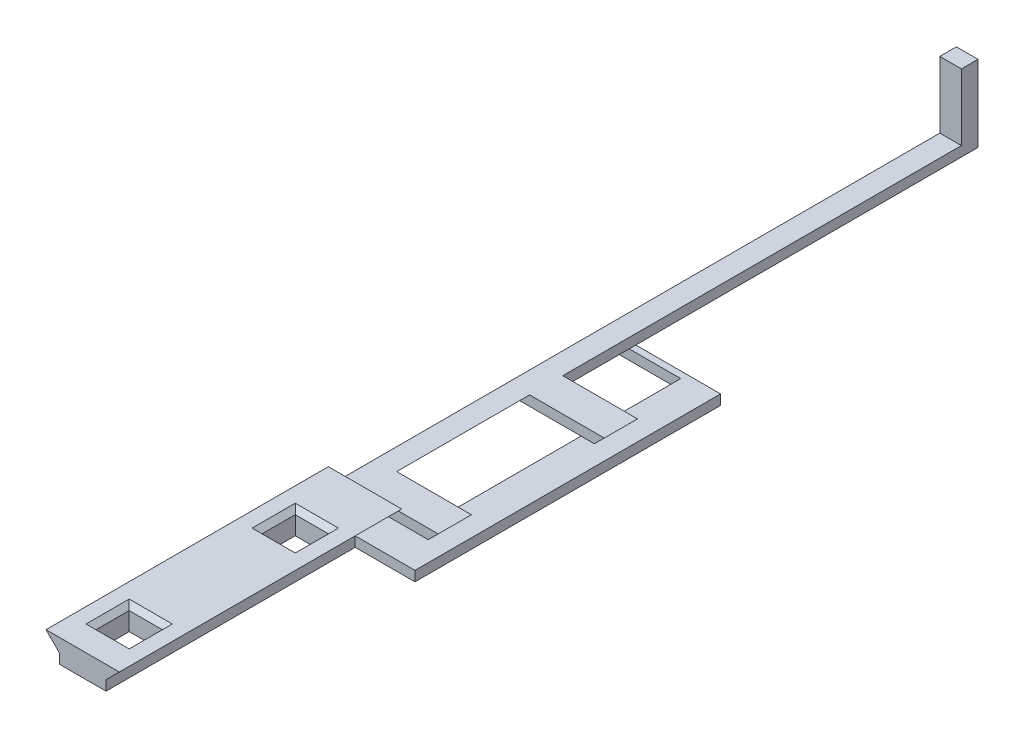
from build123d import *

# Parameters (mm, degrees)
DODANIE_WYCI_GNI_CIE4_DEPTH = 3
SFAZOWANIE2_SIZE            = 3
SZKIC7_W                    = 6.5
SZKIC7_H                    = 5
DODANIE_WYCI_GNI_CIE5_DEPTH = 20
SFAZOWANIE3_START           = -50
SFAZOWANIE3_DEPTH           = 51
SFAZOWANIE4_SIZE            = 3
DODANIE_WYCI_GNI_CIE1_DEPTH = 85
SZKIC2_W                    = 10
SZKIC2_H                    = 10
WYTNIJ_WYCI_GNI_CIE1_DEPTH  = 80
SFAZOWANIE1_SIZE            = 1.5
SZKIC3_W                    = 14.078691808
SZKIC3_H                    = 85
SZKIC3_W_2                  = 10
SZKIC3_H_2                  = 10
DODANIE_WYCI_GNI_CIE2_DEPTH = 3
DODANIE_WYCI_GNI_CIE3_DEPTH = 3


with BuildPart() as part:
    # Szkic6 → Dodanie-wyciągnięcie4 (new body)
    with BuildSketch(Plane(origin=(0, 0, 0), x_dir=(1, 0, 0), z_dir=(0, 1, 0))):
        Polygon((0, 50), (22.5, 50), (22.5, 60), (0, 60), (0, 185), (-6.5, 185), (-6.5, 60), (-6.5, 0), (0, 0), (22.5, 0), (22.5, 10), (0, 10), align=None)
    extrude(amount=DODANIE_WYCI_GNI_CIE4_DEPTH)

    # Sfazowanie2
    sfazowanie2_edges = [part.edges().sort_by_distance(p)[0] for p in [
        (0, 0, -30),
        (22.5, 0, -55),
        (22.5, 0, -5),
    ]]
    chamfer(sfazowanie2_edges, length=SFAZOWANIE2_SIZE - 0.0001)  # a hair under: the kernel refuses the full size

    # Szkic7 → Dodanie-wyciągnięcie5 (add)
    with BuildSketch(Plane(origin=(0, 3, 0), x_dir=(1, 0, 0), z_dir=(0, 1, 0))):
        with Locations((-3.25, 182.5)):
            Rectangle(SZKIC7_W, SZKIC7_H)
    extrude(amount=DODANIE_WYCI_GNI_CIE5_DEPTH)

    # Sfazowanie3: read off the stored shape, not the designer's step
    # Sfazowanie3 outline → Sfazowanie3 (cut)
    with BuildSketch(Plane.XY.offset(SFAZOWANIE3_START)):
        Polygon((-6.5, 0), (-3.5, 0), (-6.5, 3), align=None)
    extrude(amount=SFAZOWANIE3_DEPTH, mode=Mode.SUBTRACT)

    # Sfazowanie4
    # the kernel refuses this chamfer: 3 mm, written as the material it adds along each edge
    with BuildSketch(Plane(origin=(1.95536344, -5.45536344, -50), x_dir=(0, 0, 1), z_dir=(-0.7071067811865476, 0.7071067811865476, 0))) as sfazowanie4_piece_1_section:
        Polygon((SFAZOWANIE4_SIZE, 0), (0, -SFAZOWANIE4_SIZE), (0, 0), align=None)
    sfazowanie4_piece_1 = extrude(amount=19.672738615, mode=Mode.PRIVATE)
    sfazowanie4_piece_1 = split(sfazowanie4_piece_1, bisect_by=Plane(origin=(1.95536344, 3, -50), z_dir=(0, -1, 0)), keep=Keep.TOP, mode=Mode.PRIVATE)
    sfazowanie4_piece_1 = split(sfazowanie4_piece_1, bisect_by=Plane(origin=(1.95536344, 0, -50), z_dir=(0, 1, 0)), keep=Keep.TOP, mode=Mode.PRIVATE)
    sfazowanie4_piece_1 = split(sfazowanie4_piece_1, bisect_by=Plane(origin=(-6.5, -5.45536344, -50), z_dir=(1, 0, 0)), keep=Keep.TOP, mode=Mode.PRIVATE)
    add(sfazowanie4_piece_1)


with BuildPart() as body_2:
    # Szkic1 → Dodanie-wyciągnięcie1 (new body)
    with BuildSketch(Plane.XY):
        Polygon((7.5, 0), (11.5, 4), (-10.578691808, 4), (-6.578691808, 0), align=None)
    extrude(amount=DODANIE_WYCI_GNI_CIE1_DEPTH)

    # Szkic2 → Wytnij-wyciągnięcie1 (cut)
    with BuildSketch(Plane.XZ):
        with Locations((0.460654096, 21)):
            Rectangle(SZKIC2_W, SZKIC2_H)
        with Locations((0.460654096, 71)):
            Rectangle(SZKIC2_W, SZKIC2_H)
    extrude(amount=-WYTNIJ_WYCI_GNI_CIE1_DEPTH, mode=Mode.SUBTRACT)

    # Sfazowanie1
    sfazowanie1_edges = [body_2.edges().sort_by_distance(p)[0] for p in [
        (0.460654096, 4, 76),
        (-4.539345904, 4, 71),
        (0.460654096, 4, 66),
        (5.460654096, 4, 71),
        (0.460654096, 4, 26),
        (-4.539345904, 4, 21),
        (0.460654096, 4, 16),
        (5.460654096, 4, 21),
    ]]
    chamfer(sfazowanie1_edges, length=SFAZOWANIE1_SIZE)

    # Szkic3 → Dodanie-wyciągnięcie2 (add)
    with BuildSketch(Plane.XZ):
        with Locations((0.460654096, 42.5)):
            Rectangle(SZKIC3_W, SZKIC3_H)
        with Locations((0.460654096, 21)):
            Rectangle(SZKIC3_W_2, SZKIC3_H_2, mode=Mode.SUBTRACT)
        with Locations((0.460654096, 71)):
            Rectangle(SZKIC3_W_2, SZKIC3_H_2, mode=Mode.SUBTRACT)
    extrude(amount=DODANIE_WYCI_GNI_CIE2_DEPTH)

    # Szkic5 → Dodanie-wyciągnięcie3 (add)
    with BuildSketch(Plane.XZ.offset(3)):
        Polygon((7.5, 10), (7.5, 0), (15.5, 0), (15.5, -80), (-4.5, -80), (-4.5, -82), (25.5, -82), (25.5, 10), align=None)
    extrude(amount=-DODANIE_WYCI_GNI_CIE3_DEPTH)


solid = Compound([part.part, body_2.part])
